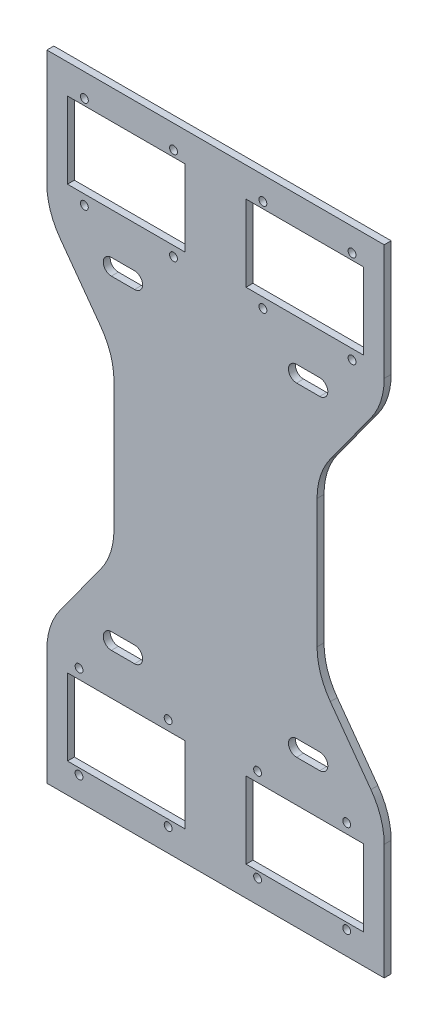
from build123d import *

# Parameters (mm, degrees)
SALIENTE_EXTRUIR1_DEPTH      = 3
REDONDEO1_R                  = 30
CORTAR_EXTRUIR1_DEPTH        = 156.335310697
SIMETR_A2_COPY_1_DEPTH       = 156.335310697
SIMETR_A2_COPY_2_DEPTH       = 156.335310697
TALADRO_DE_MARGEN_PARA_M31_D = 3.4
CROQUIS16_W                  = 50.8
CROQUIS16_H                  = 33
CORTAR_EXTRUIR2_DEPTH        = 156.335310697


with BuildPart() as part:
    # Croquis1 → Saliente-Extruir1 (new body)
    with BuildSketch(Plane.XY):
        Polygon((72.862780289, -137.153468779), (-72.862780289, -137.153468779), (-72.862780289, -77.415075694), (-43.862780289, -37.5), (-43.862780289, 37.5), (-72.862780289, 77.415075694), (-72.862780289, 137.153468779), (72.862780289, 137.153468779), (72.862780289, 77.415075694), (43.862780289, 37.5), (43.862780289, -37.5), (72.862780289, -77.415075694), align=None)
    extrude(amount=SALIENTE_EXTRUIR1_DEPTH)

    # Redondeo1
    redondeo1_edges = [part.edges().sort_by_distance(p)[0] for p in [
        (72.862780289, 77.415075694, 1.5),
        (43.862780289, 37.5, 1.5),
        (43.862780289, -37.5, 1.5),
        (72.862780289, -77.415075694, 1.5),
        (-43.862780289, -37.5, 1.5),
        (-72.862780289, -77.415075694, 1.5),
        (-43.862780289, 37.5, 1.5),
        (-72.862780289, 77.415075694, 1.5),
    ]]
    fillet(redondeo1_edges, radius=REDONDEO1_R)

    # Croquis2 → Cortar-Extruir1 (cut, through all)
    with BuildSketch(Plane.XY.offset(3)):
        with BuildLine():
            Line((-45, 73.5), (-35, 73.5))
            ThreePointArc((-35, 73.5), (-31.5, 70), (-35, 66.5))
            Line((-35, 66.5), (-45, 66.5))
            ThreePointArc((-45, 66.5), (-48.5, 70), (-45, 73.5))
        make_face()
    cortar_extruir1 = extrude(amount=-CORTAR_EXTRUIR1_DEPTH, mode=Mode.SUBTRACT)

    # Simetría1: Cortar-Extruir1 across plane
    add(cortar_extruir1.mirror(Plane.ZX), mode=Mode.SUBTRACT)

    # Simetría2 copy 1 sketch → Simetría2 copy 1 (cut, through all)
    with BuildSketch(Plane(origin=(0, 0, 3), x_dir=(-1, 0, 0), z_dir=(0, 0, 1))):
        with BuildLine():
            Line((-45, 73.5), (-35, 73.5))
            ThreePointArc((-35, 73.5), (-31.5, 70), (-35, 66.5))
            Line((-35, 66.5), (-45, 66.5))
            ThreePointArc((-45, 66.5), (-48.5, 70), (-45, 73.5))
        make_face()
    extrude(amount=-SIMETR_A2_COPY_1_DEPTH, mode=Mode.SUBTRACT)

    # Simetría2 copy 2 sketch → Simetría2 copy 2 (cut, through all)
    with BuildSketch(Plane(origin=(0, 0, 3), x_dir=(-1, 0, 0), z_dir=(0, 0, 1))):
        with BuildLine():
            Line((-45, -73.5), (-35, -73.5))
            ThreePointArc((-35, -73.5), (-31.5, -70), (-35, -66.5))
            Line((-35, -66.5), (-45, -66.5))
            ThreePointArc((-45, -66.5), (-48.5, -70), (-45, -73.5))
        make_face()
    extrude(amount=-SIMETR_A2_COPY_2_DEPTH, mode=Mode.SUBTRACT)

    # Taladro de margen para M31 (through all)
    with Locations(Plane.XY.offset(3)):
        with Locations((-56.662780289, 127.153468779), (-18.162780289, 127.153468779), (-18.162780289, 87.153468779), (-56.662780289, 87.153468779), (20.462780289, 127.153468779), (20.462780289, 87.153468779), (58.962780289, 87.153468779), (58.962780289, 127.153468779), (-58.962780289, -87.153468779), (-20.462780289, -87.153468779), (-20.462780289, -127.153468779), (-58.962780289, -127.153468779), (18.162780289, -87.153468779), (56.662780289, -87.153468779), (56.662780289, -127.153468779), (18.162780289, -127.153468779)):
            Hole(TALADRO_DE_MARGEN_PARA_M31_D / 2)

    # Croquis16 → Cortar-Extruir2 (cut, through all)
    with BuildSketch(Plane(origin=(0, 0, 0), x_dir=(-1, 0, 0), z_dir=(0, 0, -1))):
        with Locations((-38.562780289, 107.903468779)):
            Rectangle(CROQUIS16_W, CROQUIS16_H)
        with Locations((38.562780289, 107.903468779)):
            Rectangle(CROQUIS16_W, CROQUIS16_H)
        with Locations((-38.562780289, -107.903468779)):
            Rectangle(CROQUIS16_W, CROQUIS16_H)
        with Locations((38.562780289, -107.903468779)):
            Rectangle(CROQUIS16_W, CROQUIS16_H)
    extrude(amount=-CORTAR_EXTRUIR2_DEPTH, mode=Mode.SUBTRACT)


solid = part.part
